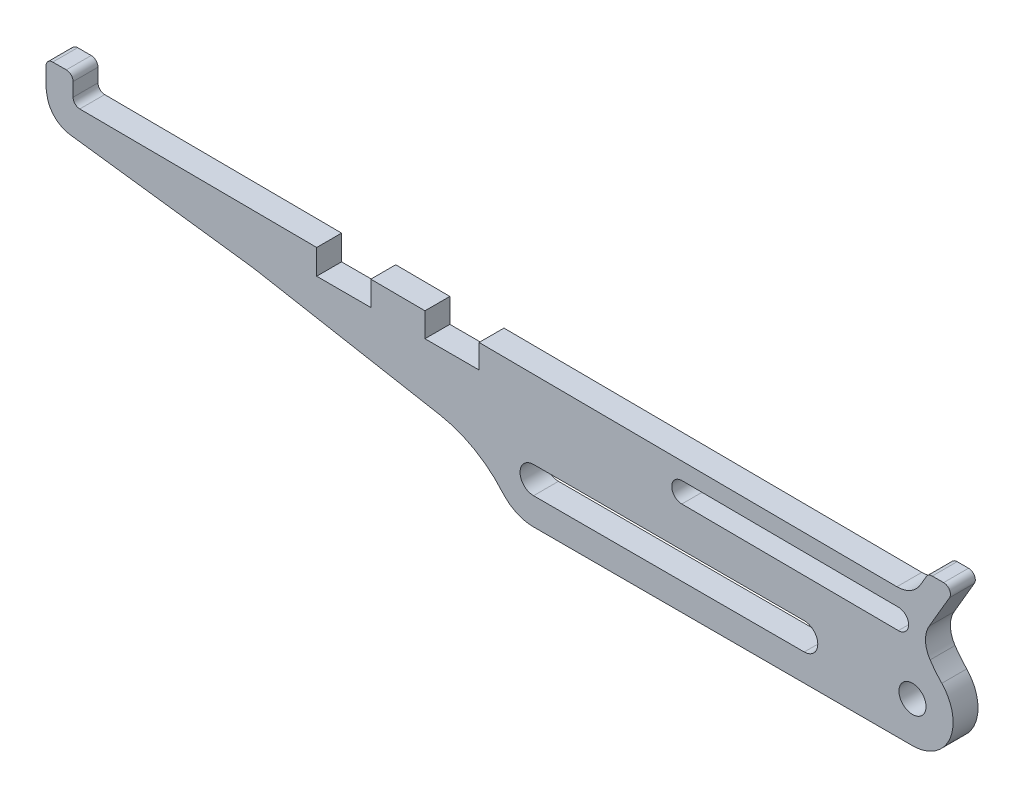
from build123d import *

# Parameters (mm, degrees)
SKETCH1_R           = 3.175
BOSS_EXTRUDE1_DEPTH = 5.842
FILLET1_R           = 25.4
SKETCH2_W           = 6.35
SKETCH2_H           = 6.35
BOSS_EXTRUDE2_DEPTH = 5.842
FILLET4_R           = 1.5875
FILLET5_R           = 25.4
FILLET6_R           = 6.35
SKETCH3_W           = 12.7
SKETCH3_H           = 5.842
CUT_EXTRUDE1_DEPTH  = 162.480283814
BOSS_EXTRUDE3_DEPTH = 5.842
FILLET7_R           = 6.35
FILLET8_R           = 1.5875
CUT_EXTRUDE2_DEPTH  = 162.480283814
BOSS_EXTRUDE4_DEPTH = 5.842
FILLET9_R           = 6.35
FILLET10_R          = 50.8


with BuildPart() as part:
    # Sketch1 → Boss-Extrude1 (new body)
    with BuildSketch(Plane.XY):
        with BuildLine():
            Line((44.45, -9.525), (-44.45, -9.525))
            ThreePointArc((-44.45, -9.525), (-51.185192091, -6.735192091), (-53.975, 0))
            Line((-53.975, 0), (-158.75, 19.05))
            Line((-158.75, 19.05), (-158.75, 22.225))
            Line((-158.75, 22.225), (44.45, 20.921420052))
            Line((44.45, 20.921420052), (44.45, 9.525))
            ThreePointArc((44.45, 9.525), (53.975, 0), (44.45, -9.525))
        make_face()
        with Locations((44.45, 0)):
            Circle(SKETCH1_R, mode=Mode.SUBTRACT)
        with BuildLine():
            Line((19.05, -3.175), (-44.45, -3.175))
            ThreePointArc((-44.45, -3.175), (-47.625, 0), (-44.45, 3.175))
            Line((-44.45, 3.175), (19.05, 3.175))
            ThreePointArc((19.05, 3.175), (22.225, 0), (19.05, -3.175))
        make_face(mode=Mode.SUBTRACT)
    extrude(amount=BOSS_EXTRUDE1_DEPTH)

    # Fillet1
    # the kernel refuses this fillet: 25.4 mm, written as the material it adds along each edge
    with BuildSketch(Plane(origin=(44.45, 9.525, 0), x_dir=(0, 1, 0), z_dir=(0, 0, 1))) as fillet1_piece_1:
        with BuildLine():
            CenterArc((14.667942914, -25.188432626), FILLET1_R, 97.400260925, 36.444857628)
            Line((-2.92692466, -6.869572534), (-3.278822011, -6.503195333))
            ThreePointArc((-3.278822011, -6.503195333), (-1.229577289, -3.534437867), (-0.508, 0))
            Line((-0.508, 0), (0, 0.508))
            ThreePointArc((0, 0.508), (5.698210026, 0.508), (11.330989595, 0.503768653))
            Line((11.330989595, 0.503768653), (11.396420052, 0))
        make_face()
    extrude(amount=5.842)

    # Sketch2 → Boss-Extrude2 (add)
    with BuildSketch(Plane.XY.offset(5.842)):
        with Locations((-155.65673172, 25.359787457)):
            Rectangle(SKETCH2_W, SKETCH2_H)
    extrude(amount=-BOSS_EXTRUDE2_DEPTH)

    # Fillet4
    # the kernel refuses this fillet: 1.5875 mm, written as the material it adds along each edge
    with BuildSketch(Plane(origin=(-152.48173172, 22.184787457, 5.842), x_dir=(0.9999794228826333, -0.00641512363991872, 0), z_dir=(0, 0, -1))) as fillet4_piece_1:
        with BuildLine():
            CenterArc((FILLET4_R * 0.993605321893, -FILLET4_R), FILLET4_R, 90, 89.632437969)
            Line((-FILLET4_R * 0.00637410098923, -FILLET4_R * 0.99358487636), (0, 0))
            Line((0, 0), (FILLET4_R * 0.993605321893, 0))
        make_face()
    extrude(amount=5.842)
    # the kernel refuses this fillet: 1.5875 mm, written as the material it takes off along each edge
    with BuildSketch(Plane(origin=(-158.83173172, 28.534787457, 9.81075), x_dir=(0, -1, 0), z_dir=(0, 0, -1)), Plane(origin=(-152.48173172, 28.534787457, 9.81075), x_dir=(-1, 0, 0), z_dir=(0, 0, -1))) as fillet4_2_piece_1:
        with BuildLine():
            CenterArc((FILLET4_R, -FILLET4_R), FILLET4_R, 90, 90)
            Line((0, -FILLET4_R), (0, 0))
            Line((0, 0), (FILLET4_R, 0))
        make_face()
    extrude(amount=13.7795, mode=Mode.SUBTRACT)
    with BuildSketch(Plane(origin=(-158.83173172, 22.184787457, 7.099025602), x_dir=(1.0, 1.4344436985779291e-12, 0), z_dir=(0, 0, -1))) as fillet4_2_piece_2:
        with BuildLine():
            CenterArc((1.5875, -0.502810241), FILLET4_R, 161.534664076, 18.465335924)
            Line((0, -0.502810241), (0, 0))
            Line((0, 0), (0.08173172, 0))
        make_face()
    extrude(amount=8.356051205, mode=Mode.SUBTRACT)

    # Fillet5
    fillet5_edges = [part.edges().sort_by_distance(p)[0] for p in [
        (-53.975, 0, 2.921),
    ]]
    fillet(fillet5_edges, radius=FILLET5_R)

    # Fillet6
    # the kernel refuses this fillet: 6.35 mm, written as the material it takes off along each edge
    with BuildSketch(Plane(origin=(-158.75, 19.05, -12.212686772), x_dir=(0.9838699100999072, -0.17888543819998437, 0), z_dir=(0, 0, 1))) as fillet6_piece_1:
        with BuildLine():
            CenterArc((4.885074709, 6.35), FILLET6_R, 210.950382336, 59.049617664)
            Line((-0.560767828, 3.084223053), (0, 0))
            Line((0, 0), (4.885074709, 0))
        make_face()
    extrude(amount=30.267373544, mode=Mode.SUBTRACT)

    # Sketch3 → Cut-Extrude1 (cut, through all)
    with BuildSketch(Plane.XY.offset(5.842)):
        with Locations((-88.98173172, 18.897155596)):
            Rectangle(SKETCH3_W, SKETCH3_H)
        with Locations((-63.58173172, 18.897155596)):
            Rectangle(SKETCH3_W, SKETCH3_H)
    extrude(amount=-CUT_EXTRUDE1_DEPTH, mode=Mode.SUBTRACT)

    # Sketch4 → Boss-Extrude3 (add)
    with BuildSketch(Plane.XY.offset(5.842)):
        Polygon((44.45, 20.921420052), (48.170691966, 27.271420052), (54.520691966, 27.271420052), (46.540749413, 13.626153894), (43.362669871, 15.484739273), align=None)
    extrude(amount=-BOSS_EXTRUDE3_DEPTH)

    # Fillet7
    fillet7_edges = [part.edges().sort_by_distance(p)[0] for p in [
        (44.45, 20.921420052, 2.921),
        (46.540749413, 13.626153894, 2.921),
    ]]
    fillet(fillet7_edges, radius=FILLET7_R)

    # Fillet8
    fillet8_edges = [part.edges().sort_by_distance(p)[0] for p in [
        (48.170691966, 27.271420052, 2.921),
        (54.520691966, 27.271420052, 2.921),
    ]]
    fillet(fillet8_edges, radius=FILLET8_R)

    # Sketch5 → Cut-Extrude2 (cut, through all)
    with BuildSketch(Plane.XY.offset(5.842)):
        with BuildLine():
            Line((41.13300152, 12.211269778), (-9.665953162, 12.537158059))
            ThreePointArc((-9.665953162, 12.537158059), (-12.03187815, 14.933635073), (-9.635401136, 17.29956006))
            Line((-9.635401136, 17.29956006), (41.163553547, 16.97367178))
            ThreePointArc((41.163553547, 16.97367178), (43.529478534, 14.577194766), (41.13300152, 12.211269778))
        make_face()
    extrude(amount=-CUT_EXTRUDE2_DEPTH, mode=Mode.SUBTRACT)

    # Sketch6 → Boss-Extrude4 (add)
    with BuildSketch(Plane.XY.offset(5.842)):
        Polygon((-158.811165573, 22.432892862), (-157.831118293, 16.403681612), (-110.184513465, 10.219911539), align=None)
    extrude(amount=-BOSS_EXTRUDE4_DEPTH)

    # Fillet9
    fillet9_edges = [part.edges().sort_by_distance(p)[0] for p in [
        (-157.831118293, 16.403681612, 2.921),
    ]]
    fillet(fillet9_edges, radius=FILLET9_R)

    # Fillet10
    # the kernel refuses this fillet: 50.8 mm, written as the material it adds along each edge
    with BuildSketch(Plane(origin=(-110.184513465, 10.219911539, 5.842), x_dir=(-0.9916829703779194, 0.1287046474002651, 0), z_dir=(0, 0, -1))) as fillet10_piece_1:
        with BuildLine():
            CenterArc((FILLET10_R * 0.0254008846311, -FILLET10_R), FILLET10_R, 90, 2.910101208)
            Line((-FILLET10_R * 0.0253681282132, -FILLET10_R * 0.0012895778381), (0, 0))
            Line((0, 0), (FILLET10_R * 0.0254008846311, 0))
        make_face()
    extrude(amount=5.842)


solid = part.part
